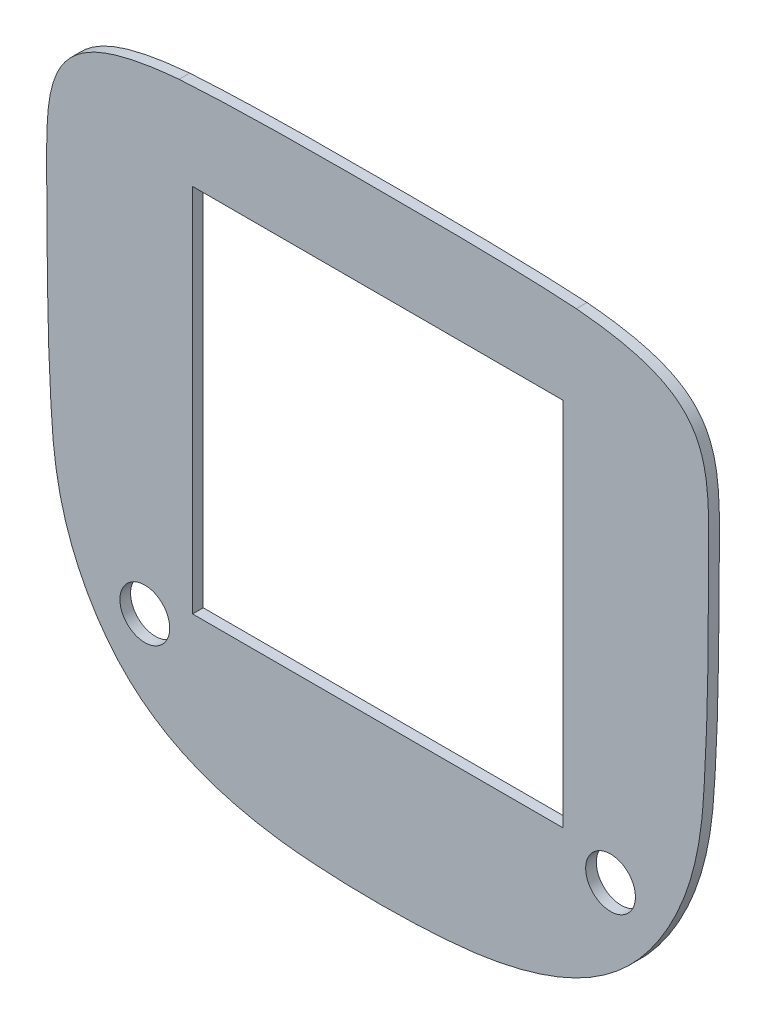
from build123d import *

# Parameters (mm, degrees)
SKETCH1_R           = 7
SKETCH1_R_2         = 7.000000001
SKETCH1_W           = 104.14
SKETCH1_H           = 104.14
BOSS_EXTRUDE1_DEPTH = 3


with BuildPart() as part:
    # Sketch1 → Boss-Extrude1 (new body)
    with BuildSketch(Plane(origin=(0, 0, 100), x_dir=(-1, 0, 0), z_dir=(0, 0, -1))):
        with BuildLine():
            add(Edge.make_bspline(
                [(27.354996181, -67.060879103), (22.810849587, -67.61572874), (18.26167606, -67.986690539), (9.155974583, -68.45958548), (4.599442657, -68.561373141), (-4.5191536, -68.562570158), (-9.081211272, -68.462223125), (-15.929855414, -68.108401377), (-18.213670582, -67.956302347), (-22.783487053, -67.57213436), (-25.072712268, -67.339550598), (-27.354987555, -67.060880265)],
                knots=[0, 0, 0, 0, 0.25, 0.25, 0.5, 0.5, 0.75, 0.75, 0.875, 0.875, 1, 1, 1, 1], degree=3))
            add(Edge.make_bspline(
                [(55.865874118, 104.1311973), (58.25323506, 103.919485239), (60.633299285, 103.660942446), (65.36993385, 102.993071788), (67.726731787, 102.585204653), (71.232870836, 101.786909004), (72.396630414, 101.489019011), (74.711083954, 100.809383177), (75.862791021, 100.427501655), (78.111787638, 99.564492237), (79.212848974, 99.082011708), (80.818526604, 98.258426356), (81.34608153, 97.967213457), (82.383827778, 97.347021517), (82.895823909, 97.016816878), (84.381096706, 95.974954836), (85.307469822, 95.210186162), (86.586467989, 93.941407948), (86.994343068, 93.49817721), (87.771112538, 92.568834315), (88.140266106, 92.081844394), (89.165806708, 90.588282085), (89.748480498, 89.538928359), (90.490153707, 87.894621427), (90.715469177, 87.334884621), (91.12652602, 86.194395624), (91.311285018, 85.615987959), (91.806494684, 83.878547723), (92.06075633, 82.709232951), (92.466986712, 80.355745386), (92.618918736, 79.171567261), (92.851712625, 76.792888086), (92.93262682, 75.598394638), (93.050048202, 73.202957633), (93.085627223, 72.001256128), (93.127022177, 69.599455444), (93.13452068, 68.398603279), (93.128744172, 65.996974774), (93.118023371, 64.79618911), (93.09254292, 61.193807731), (93.079089175, 58.792207247), (93.036967319, 51.587412225), (93.008523986, 46.784216865), (92.858256006, 32.374867812), (92.67642409, 22.768446583), (92.115316937, 10.773329313), (91.98627986, 8.374882137), (91.761241203, 4.780673639), (91.681539526, 3.58304692), (91.511823037, 1.188767393), (91.423288984, -0.00802525), (91.090684332, -3.592075872), (90.789621467, -5.97395185), (90.200214007, -9.533751581), (89.980627701, -10.718097152), (89.495248731, -13.06626012), (89.229115135, -14.231985354), (88.357072081, -17.702912538), (87.677264493, -19.981774772), (86.102628231, -24.462858676), (85.206602939, -26.664653831), (83.7035175, -29.910656822), (83.175745614, -30.983125592), (82.065473035, -33.108555991), (81.4813518, -34.164096071), (79.654958218, -37.28019984), (78.344172747, -39.28325783), (75.519955329, -43.127707362), (74.005553588, -44.968325226), (71.557636189, -47.588592358), (70.712262415, -48.438559085), (68.959694862, -50.089174036), (68.04990556, -50.891594884), (63.410781816, -54.719776185), (59.366533806, -57.235822118), (53.977202375, -59.832620195), (52.882545333, -60.324419636), (50.661134354, -61.255335001), (49.536422344, -61.693559149), (46.142729716, -62.926119647), (43.846612605, -63.641949001), (39.197998952, -64.896241562), (36.845146863, -65.434098403), (32.119484653, -66.355028737), (29.742885871, -66.739227187), (27.354996181, -67.060879103)],
                knots=[0, 0, 0, 0, 0.03125, 0.03125, 0.0625, 0.0625, 0.078125, 0.078125, 0.09375, 0.09375, 0.109375, 0.109375, 0.1171875, 0.1171875, 0.125, 0.125, 0.140625, 0.140625, 0.1484375, 0.1484375, 0.15625, 0.15625, 0.171875, 0.171875, 0.1796875, 0.1796875, 0.1875, 0.1875, 0.203125, 0.203125, 0.21875, 0.21875, 0.234375, 0.234375, 0.25, 0.25, 0.265625, 0.265625, 0.28125, 0.28125, 0.3125, 0.3125, 0.375, 0.375, 0.5, 0.5, 0.53125, 0.53125, 0.546875, 0.546875, 0.5625, 0.5625, 0.59375, 0.59375, 0.609375, 0.609375, 0.625, 0.625, 0.65625, 0.65625, 0.6875, 0.6875, 0.703125, 0.703125, 0.71875, 0.71875, 0.75, 0.75, 0.78125, 0.78125, 0.796875, 0.796875, 0.8125, 0.8125, 0.875, 0.875, 0.890625, 0.890625, 0.90625, 0.90625, 0.9375, 0.9375, 0.96875, 0.96875, 1, 1, 1, 1], degree=3))
            add(Edge.make_bspline(
                [(-55.865874218, 104.131197291), (-51.293318379, 104.426791057), (-46.713806975, 104.633042408), (-37.546798915, 104.942976611), (-32.958514463, 105.045780911), (-23.780900734, 105.190245101), (-19.191870629, 105.231621959), (-10.013567793, 105.280841225), (-5.209171926, 105.288915988), (-0.404721473, 105.28944639), (-0.117888465, 105.289457862), (-0.047586157, 105.289459108), (2.09526554, 105.289447311), (4.164203424, 105.288090763), (8.597564794, 105.280557628), (10.961977486, 105.273732137), (18.055002772, 105.24046333), (22.783409117, 105.201620758), (32.239170037, 105.06070581), (36.966530075, 104.958961831), (46.41943425, 104.646306361), (51.147249034, 104.436233731), (55.865874118, 104.1311973)],
                knots=[0, 0, 0, 0, 0.125, 0.125, 0.25, 0.25, 0.375, 0.375, 0.5, 0.505859375, 0.505859375, 0.5078125, 0.5078125, 0.5625, 0.5625, 0.625, 0.625, 0.75, 0.75, 0.875, 0.875, 1, 1, 1, 1], degree=3))
            add(Edge.make_bspline(
                [(-27.354987555, -67.060880265), (-32.132733032, -66.417311906), (-36.862186688, -65.526376788), (-42.684741106, -63.955474908), (-43.841881664, -63.618960456), (-46.131932137, -62.900307034), (-47.266074456, -62.517838987), (-50.633370608, -61.295733032), (-52.831301237, -60.38119683), (-57.119030907, -58.322194425), (-59.209191741, -57.178497537), (-62.251200118, -55.264702687), (-63.2496146, -54.593624231), (-64.721946217, -53.533229905), (-65.209380763, -53.1700836), (-66.167657422, -52.431364082), (-66.639251655, -52.055309907), (-68.959967385, -50.141979617), (-70.696985038, -48.505225746), (-73.948299187, -45.034081592), (-75.462780611, -43.19985541), (-77.586560121, -40.317236064), (-78.26993027, -39.334572339), (-79.589779893, -37.32763544), (-80.227776249, -36.300663992), (-82.061569923, -33.17842148), (-83.172187966, -31.053175154), (-85.182998949, -26.720417404), (-86.083503659, -24.513027864), (-87.667602871, -20.013448352), (-88.352286816, -17.721684294), (-89.230671608, -14.225927379), (-89.499102732, -13.049318915), (-89.986998715, -10.685535789), (-90.206048276, -9.501090729), (-90.794258511, -5.940685458), (-91.094682017, -3.5576758), (-91.426317095, 0.029042936), (-91.514657674, 1.22689306), (-91.684257683, 3.623319525), (-91.76395141, 4.82205644), (-91.988842587, 8.419722463), (-92.117754717, 10.820448481), (-92.678420073, 22.831358799), (-92.859519757, 32.448117676), (-93.009212958, 46.874567517), (-93.037534722, 51.683354172), (-93.079695754, 58.896533707), (-93.093255898, 61.300926201), (-93.118834804, 64.907522215), (-93.129614171, 66.109724014), (-93.13414069, 68.514103964), (-93.125913923, 69.716279374), (-93.082572133, 72.120592858), (-93.045713751, 73.322728512), (-92.92462249, 75.72693404), (-92.84105985, 76.930813237), (-92.600704592, 79.324847731), (-92.444071297, 80.515672957), (-92.025972761, 82.879517624), (-91.764392204, 84.05251748), (-91.256354676, 85.792371191), (-91.068219843, 86.36699017), (-90.652807731, 87.494196583), (-90.42514299, 88.048176521), (-89.675289617, 89.677879563), (-89.085812693, 90.721158979), (-88.045055936, 92.2106002), (-87.67505807, 92.690115503), (-86.898373027, 93.604834331), (-86.490397246, 94.041807462), (-85.210313494, 95.294416603), (-84.282139076, 96.05183577), (-82.791406704, 97.085716987), (-82.28186919, 97.410712775), (-81.248526963, 98.02216714), (-80.72340151, 98.309364768), (-79.125617827, 99.121847036), (-78.030625017, 99.598180501), (-75.794991188, 100.450799283), (-74.651796989, 100.828183594), (-72.343095495, 101.50327884), (-71.182475696, 101.799250612), (-67.686358399, 102.592608648), (-65.337028385, 102.998258772), (-60.616238408, 103.662794946), (-58.244563311, 103.920254251), (-55.865874218, 104.131197291)],
                knots=[0, 0, 0, 0, 0.0625, 0.0625, 0.078125, 0.078125, 0.09375, 0.09375, 0.125, 0.125, 0.15625, 0.15625, 0.171875, 0.171875, 0.1796875, 0.1796875, 0.1875, 0.1875, 0.21875, 0.21875, 0.25, 0.25, 0.265625, 0.265625, 0.28125, 0.28125, 0.3125, 0.3125, 0.34375, 0.34375, 0.375, 0.375, 0.390625, 0.390625, 0.40625, 0.40625, 0.4375, 0.4375, 0.453125, 0.453125, 0.46875, 0.46875, 0.5, 0.5, 0.625, 0.625, 0.6875, 0.6875, 0.71875, 0.71875, 0.734375, 0.734375, 0.75, 0.75, 0.765625, 0.765625, 0.78125, 0.78125, 0.796875, 0.796875, 0.8125, 0.8125, 0.8203125, 0.8203125, 0.828125, 0.828125, 0.84375, 0.84375, 0.8515625, 0.8515625, 0.859375, 0.859375, 0.875, 0.875, 0.8828125, 0.8828125, 0.890625, 0.890625, 0.90625, 0.90625, 0.921875, 0.921875, 0.9375, 0.9375, 0.96875, 0.96875, 1, 1, 1, 1], degree=3))
        make_face()
        with Locations((-65.5, -30.887752409)):
            Circle(SKETCH1_R, mode=Mode.SUBTRACT)
        with Locations((65.5, -30.887752409)):
            Circle(SKETCH1_R_2, mode=Mode.SUBTRACT)
        with Locations((0, 27.871196428)):
            Rectangle(SKETCH1_W, SKETCH1_H, mode=Mode.SUBTRACT)
    extrude(amount=BOSS_EXTRUDE1_DEPTH)


solid = part.part
